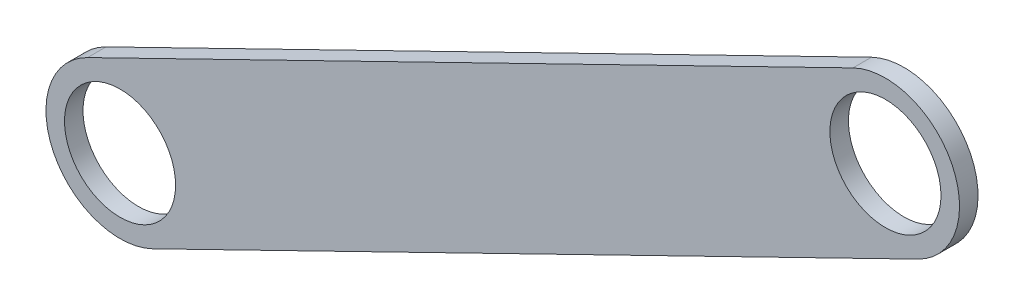
from build123d import *

# Parameters (mm, degrees)
ESQUISSE2_R               = 3
T_LE_DE_BASE_PLI_E1_DEPTH = 1


# Sheet-metal steps are written as plain solids
with BuildPart() as part:
    # Esquisse2 → Tôle de base pliée1 (new body)
    with BuildSketch(Plane.XY):
        with BuildLine():
            Line((1.755119014, -15.594378562), (-39.580234449, -35.778247223))
            ThreePointArc((-39.580234449, -35.778247223), (-44.929732025, -33.938987675), (-43.090472477, -28.589490099))
            Line((-43.090472477, -28.589490099), (-1.755119014, -8.405621438))
            ThreePointArc((-1.755119014, -8.405621438), (3.594378562, -10.244880986), (1.755119014, -15.594378562))
        make_face()
        with Locations((0, -12)):
            Circle(ESQUISSE2_R, mode=Mode.SUBTRACT)
        with Locations((-41.335353463, -32.183868661)):
            Circle(ESQUISSE2_R, mode=Mode.SUBTRACT)
    extrude(amount=T_LE_DE_BASE_PLI_E1_DEPTH)


solid = part.part
